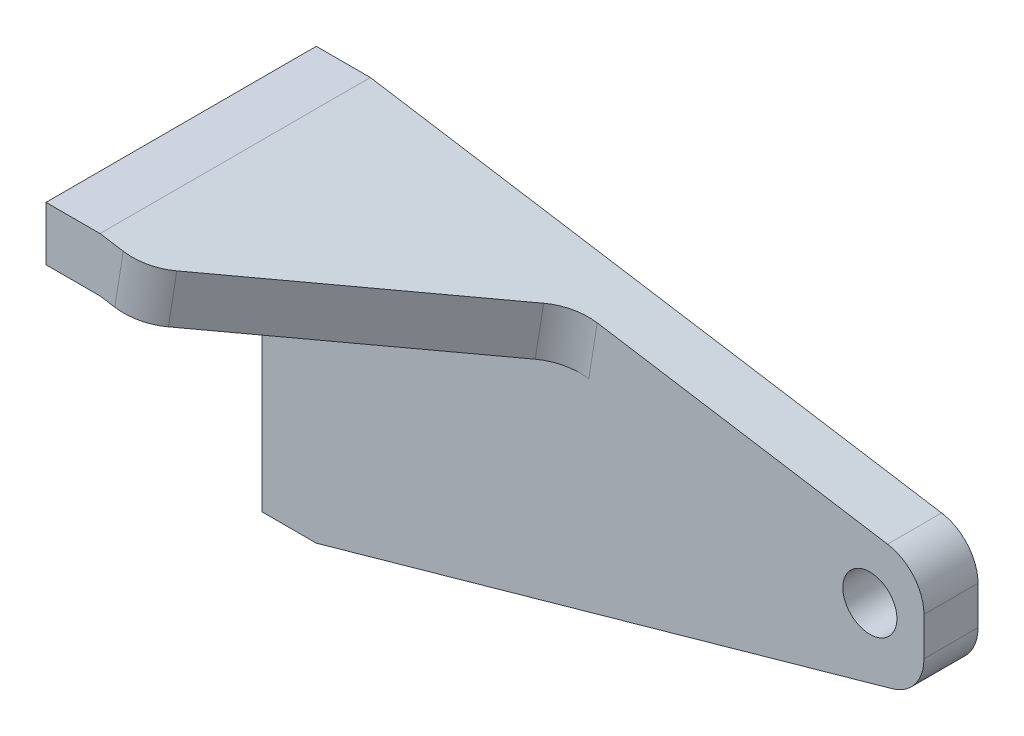
from build123d import *

# Parameters (mm, degrees)
SKETCH1_R           = 1.5875
BOSS_EXTRUDE1_DEPTH = 3.175
BOSS_EXTRUDE2_DEPTH = 12.7
CHAMFER1_SIZE       = 13.716
FILLET1_R           = 3.175


with BuildPart() as part:
    # Sketch1 → Boss-Extrude1 (new body)
    with BuildSketch(Plane.XY.offset(-69.251165667)):
        with BuildLine():
            Line((-122.696825859, 83.333454018), (-119.521825859, 83.333454018))
            Line((-119.521825859, 83.333454018), (-85.973181885, 77.960895375))
            ThreePointArc((-85.973181885, 77.960895375), (-84.441981363, 77.100793683), (-83.834825859, 75.45285189))
            Line((-83.834825859, 75.45285189), (-83.834825859, 73.192832287))
            ThreePointArc((-83.834825859, 73.192832287), (-84.350263921, 71.658964965), (-85.687384095, 70.747628037))
            Line((-85.687384095, 70.747628037), (-119.521825859, 61.235454018))
            Line((-119.521825859, 61.235454018), (-122.696825859, 61.235454018))
            Line((-122.696825859, 61.235454018), (-122.696825859, 83.333454018))
        make_face()
        with Locations((-87.009825859, 74.443454018)):
            Circle(SKETCH1_R, mode=Mode.SUBTRACT)
    extrude(amount=BOSS_EXTRUDE1_DEPTH)

    # Sketch2 → Boss-Extrude2 (add)
    with BuildSketch(Plane.XY.offset(-66.076165667)):
        Polygon((-103.813644634, 77.642908982), (-103.317906173, 80.738520261), (-119.521825859, 83.333454018), (-122.696825859, 83.333454018), (-122.696825859, 80.158454018), (-119.521825859, 80.158454018), align=None)
    extrude(amount=BOSS_EXTRUDE2_DEPTH)

    # Chamfer1
    # the kernel refuses this chamfer: 13.716 mm, written as the material it takes off along each edge
    with BuildSketch(Plane(origin=(-109.391309905, 42.813488073, -53.376165667), x_dir=(0.02714994258719934, -0.004347855574462481, -0.9996219169112966), z_dir=(0.15812754894268197, 0.987418694508758, 0))) as chamfer1_piece_1_section:
        Polygon((CHAMFER1_SIZE * 0.999621916911, CHAMFER1_SIZE * 0.0274958766106), (-CHAMFER1_SIZE * 0.0274958766106, CHAMFER1_SIZE * 0.999621916911), (0, 0), align=None)
    chamfer1_piece_1 = extrude(amount=73.681462081, mode=Mode.PRIVATE)
    chamfer1_piece_1 = split(chamfer1_piece_1, bisect_by=Plane(origin=(-108.089526316, 79.915158718, -66.076165667), z_dir=(0, 0, 1)), keep=Keep.TOP, mode=Mode.PRIVATE)
    add(chamfer1_piece_1, mode=Mode.SUBTRACT)

    # Fillet1
    fillet1_edges = [part.edges().sort_by_distance(p)[0] for p in [
        (-117.109210218, 81.359592083, -53.376165667),
        (-104.568992798, 79.351372211, -66.076165667),
    ]]
    fillet(fillet1_edges, radius=FILLET1_R)


solid = part.part
